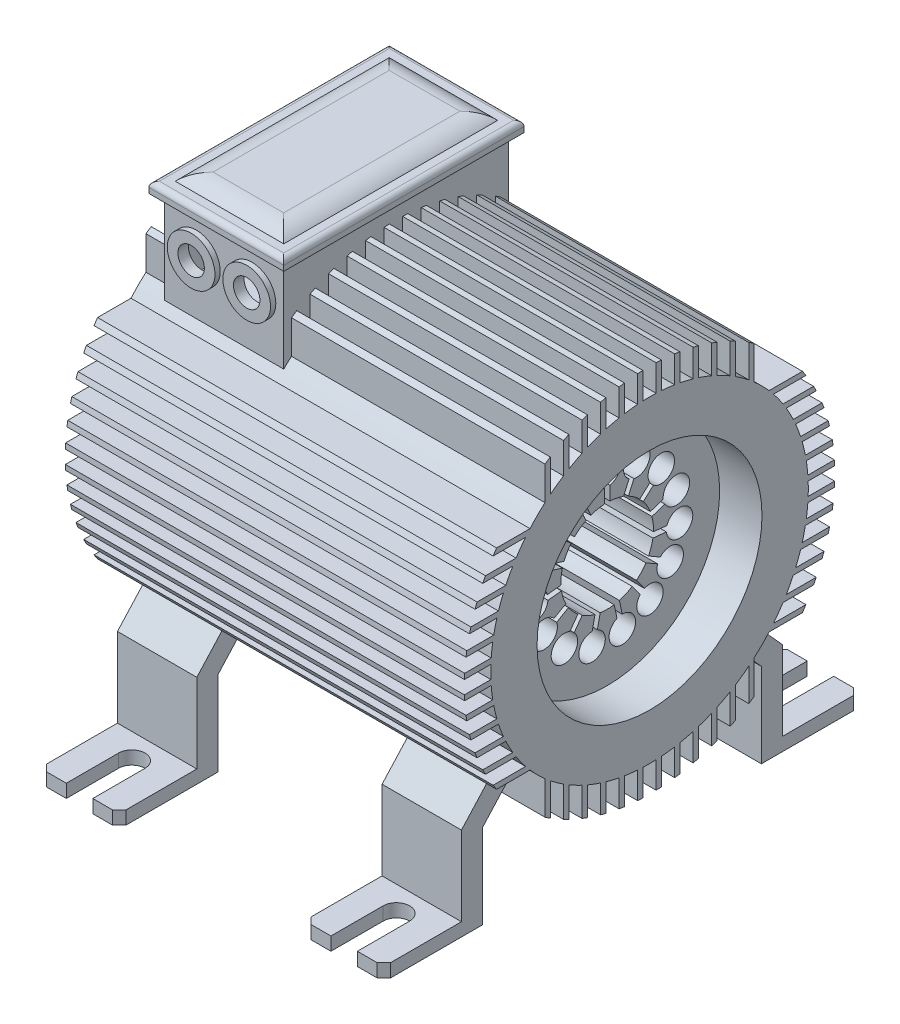
from build123d import *

# Parameters (mm, degrees)
CUT_EXTRUDE2_REACH      = 335.587
CUT_EXTRUDE3_REACH      = 342.367
CIRPATTERN1_START       = 143.1
CIRPATTERN1_DEPTH       = 150.8
BOSS_EXTRUDE4_START     = 50
BOSS_EXTRUDE4_DEPTH     = 15
BOSS_EXTRUDE5_START     = -50
BOSS_EXTRUDE5_DEPTH     = 15
CUT_EXTRUDE5_REACH      = 346.945
CHAMFER2_SIZE           = 2.5
BOSS_EXTRUDE8_START     = -10
BOSS_EXTRUDE8_DEPTH     = 45
SKETCH15_W              = 41
SKETCH15_H              = 80.852813742
CUT_EXTRUDE8_DEPTH      = 30
SKETCH16_R              = 9
BOSS_EXTRUDE9_DEPTH     = 2
BOSS_EXTRUDE10_START    = -86.852814
SKETCH16_3_R            = 9
BOSS_EXTRUDE10_DEPTH    = 2
CUT_EXTRUDE9_DEPTH      = 444.384032682
CUT_EXTRUDE9_DEPTH_BACK = 444.384032682
SKETCH16_4_R            = 5
SKETCH17_W              = 51
SKETCH17_H              = 90.852813742
BOSS_EXTRUDE11_DEPTH    = 4
SKETCH18_W              = 41
SKETCH18_H              = 80.852813742
BOSS_EXTRUDE12_DEPTH    = 3
FILLET1_R               = 10
FILLET2_R               = 2


# Read off the part's stored shape, not the designer's step: CirPattern1
with BuildPart() as part:
    # Sketch1 → Revolve1 (revolve)
    with BuildSketch(Plane.XY, mode=Mode.PRIVATE) as revolve1_sk:
        Polygon((143.1, 297), (293.9, 297), (293.9, 269.5), (277.9, 269.5), (277.9, 244.5), (159.1, 244.5), (159.1, 269.5), (143.1, 269.5), align=None)
    revolve(revolve1_sk.sketch.rotate(Axis((-3.075212366, 227, 0), (1, 0, 0)), 90), axis=Axis((-3.075212366, 227, 0), (1, 0, 0)))

    # Sketch2 → Cut-Extrude2 (cut, up to next)
    with BuildSketch(Plane(origin=(277.9, 0, 0), x_dir=(0, 0, -1), z_dir=(1, 0, 0)), mode=Mode.PRIVATE) as cut_extrude2_sk1:
        with BuildLine():
            Line((-1, 249.601020514), (-1, 244.47140521))
            ThreePointArc((-1, 244.47140521), (0, 244.5), (1, 244.47140521))
            Line((1, 244.47140521), (1, 249.601020514))
            ThreePointArc((1, 249.601020514), (0, 259.5), (-1, 249.601020514))
        make_face()
    cut_extrude2_tool1 = extrude(cut_extrude2_sk1.sketch, amount=-CUT_EXTRUDE2_REACH, mode=Mode.PRIVATE) & part.part
    # Sketch2 → Cut-Extrude2 (cut, up to next)
    with BuildSketch(Plane(origin=(277.9, 0, 0), x_dir=(0, 0, -1), z_dir=(1, 0, 0)), mode=Mode.PRIVATE) as cut_extrude2_sk2:
        with BuildLine():
            Line((8.279117756, 248.053796272), (6.192715247, 243.367659511))
            ThreePointArc((6.192715247, 243.367659511), (7.117891254, 242.987045509), (8.019806162, 242.554186225))
            Line((8.019806162, 242.554186225), (10.106208672, 247.240322986))
            ThreePointArc((10.106208672, 247.240322986), (13.2189409, 256.690227373), (8.279117756, 248.053796272))
        make_face()
    cut_extrude2_tool2 = extrude(cut_extrude2_sk2.sketch, amount=-CUT_EXTRUDE2_REACH, mode=Mode.PRIVATE) & part.part
    # Sketch2 → Cut-Extrude2 (cut, up to next)
    with BuildSketch(Plane(origin=(277.9, 0, 0), x_dir=(0, 0, -1), z_dir=(1, 0, 0)), mode=Mode.PRIVATE) as cut_extrude2_sk3:
        with BuildLine():
            Line((16.126700839, 242.866179387), (12.314653769, 239.433796787))
            ThreePointArc((12.314653769, 239.433796787), (13.005034446, 238.709785611), (13.652914982, 237.947507136))
            Line((13.652914982, 237.947507136), (17.464962052, 241.379889736))
            ThreePointArc((17.464962052, 241.379889736), (24.152206828, 248.746744707), (16.126700839, 242.866179387))
        make_face()
    cut_extrude2_tool3 = extrude(cut_extrude2_sk3.sketch, amount=-CUT_EXTRUDE2_REACH, mode=Mode.PRIVATE) & part.part
    # Sketch2 → Cut-Extrude2 (cut, up to next)
    with BuildSketch(Plane(origin=(277.9, 0, 0), x_dir=(0, 0, -1), z_dir=(1, 0, 0)), mode=Mode.PRIVATE) as cut_extrude2_sk4:
        with BuildLine():
            Line((21.185830841, 234.935155945), (16.307276779, 233.350017642))
            ThreePointArc((16.307276779, 233.350017642), (16.643489035, 232.407797402), (16.925310768, 231.447904609))
            Line((16.925310768, 231.447904609), (21.80386483, 233.033042913))
            ThreePointArc((21.80386483, 233.033042913), (30.90933678, 237.043052317), (21.185830841, 234.935155945))
        make_face()
    cut_extrude2_tool4 = extrude(cut_extrude2_sk4.sketch, amount=-CUT_EXTRUDE2_REACH, mode=Mode.PRIVATE) & part.part
    # Sketch2 → Cut-Extrude2 (cut, up to next)
    with BuildSketch(Plane(origin=(277.9, 0, 0), x_dir=(0, 0, -1), z_dir=(1, 0, 0)), mode=Mode.PRIVATE) as cut_extrude2_sk5:
        with BuildLine():
            Line((22.581738223, 225.632071953), (17.480223487, 226.168262758))
            ThreePointArc((17.480223487, 226.168262758), (17.404133169, 225.170751893), (17.271166561, 224.179218967))
            Line((17.271166561, 224.179218967), (22.372681296, 223.643028162))
            ThreePointArc((22.372681296, 223.643028162), (32.321961599, 223.602824944), (22.581738223, 225.632071953))
        make_face()
    cut_extrude2_tool5 = extrude(cut_extrude2_sk5.sketch, amount=-CUT_EXTRUDE2_REACH, mode=Mode.PRIVATE) & part.part
    # Sketch2 → Cut-Extrude2 (cut, up to next)
    with BuildSketch(Plane(origin=(277.9, 0, 0), x_dir=(0, 0, -1), z_dir=(1, 0, 0)), mode=Mode.PRIVATE) as cut_extrude2_sk6:
        with BuildLine():
            Line((20.073057917, 216.565515147), (15.630680751, 219.130322799))
            ThreePointArc((15.630680751, 219.130322799), (15.155444566, 218.25), (14.630680751, 217.398271991))
            Line((14.630680751, 217.398271991), (19.073057917, 214.833464339))
            ThreePointArc((19.073057917, 214.833464339), (28.145825623, 210.75), (20.073057917, 216.565515147))
        make_face()
    cut_extrude2_tool6 = extrude(cut_extrude2_sk6.sketch, amount=-CUT_EXTRUDE2_REACH, mode=Mode.PRIVATE) & part.part
    # Sketch2 → Cut-Extrude2 (cut, up to next)
    with BuildSketch(Plane(origin=(277.9, 0, 0), x_dir=(0, 0, -1), z_dir=(1, 0, 0)), mode=Mode.PRIVATE) as cut_extrude2_sk7:
        with BuildLine():
            Line((14.09356354, 209.303175566), (11.078451313, 213.453121522))
            ThreePointArc((11.078451313, 213.453121522), (10.286241915, 212.842202598), (9.460417325, 212.277551017))
            Line((9.460417325, 212.277551017), (12.475529551, 208.127605061))
            ThreePointArc((12.475529551, 208.127605061), (19.1030207, 200.706947683), (14.09356354, 209.303175566))
        make_face()
    cut_extrude2_tool7 = extrude(cut_extrude2_sk7.sketch, amount=-CUT_EXTRUDE2_REACH, mode=Mode.PRIVATE) & part.part
    # Sketch2 → Cut-Extrude2 (cut, up to next)
    with BuildSketch(Plane(origin=(277.9, 0, 0), x_dir=(0, 0, -1), z_dir=(1, 0, 0)), mode=Mode.PRIVATE) as cut_extrude2_sk8:
        with BuildLine():
            Line((5.67716399, 205.1007777), (4.610656999, 210.118298604))
            ThreePointArc((4.610656999, 210.118298604), (3.638454589, 209.882416987), (2.654361797, 209.702475222))
            Line((2.654361797, 209.702475222), (3.720868789, 204.684954319))
            ThreePointArc((3.720868789, 204.684954319), (6.757129952, 195.210202976), (5.67716399, 205.1007777))
        make_face()
    cut_extrude2_tool8 = extrude(cut_extrude2_sk8.sketch, amount=-CUT_EXTRUDE2_REACH, mode=Mode.PRIVATE) & part.part
    # Sketch2 → Cut-Extrude2 (cut, up to next)
    with BuildSketch(Plane(origin=(277.9, 0, 0), x_dir=(0, 0, -1), z_dir=(1, 0, 0)), mode=Mode.PRIVATE) as cut_extrude2_sk9:
        with BuildLine():
            Line((-3.720868789, 204.684954319), (-2.654361797, 209.702475222))
            ThreePointArc((-2.654361797, 209.702475222), (-3.638454589, 209.882416987), (-4.610656999, 210.118298604))
            Line((-4.610656999, 210.118298604), (-5.67716399, 205.1007777))
            ThreePointArc((-5.67716399, 205.1007777), (-6.757129952, 195.210202976), (-3.720868789, 204.684954319))
        make_face()
    cut_extrude2_tool9 = extrude(cut_extrude2_sk9.sketch, amount=-CUT_EXTRUDE2_REACH, mode=Mode.PRIVATE) & part.part
    # Sketch2 → Cut-Extrude2 (cut, up to next)
    with BuildSketch(Plane(origin=(277.9, 0, 0), x_dir=(0, 0, -1), z_dir=(1, 0, 0)), mode=Mode.PRIVATE) as cut_extrude2_sk10:
        with BuildLine():
            Line((-12.475529551, 208.127605061), (-9.460417325, 212.277551017))
            ThreePointArc((-9.460417325, 212.277551017), (-10.286241915, 212.842202598), (-11.078451313, 213.453121522))
            Line((-11.078451313, 213.453121522), (-14.09356354, 209.303175566))
            ThreePointArc((-14.09356354, 209.303175566), (-19.1030207, 200.706947683), (-12.475529551, 208.127605061))
        make_face()
    cut_extrude2_tool10 = extrude(cut_extrude2_sk10.sketch, amount=-CUT_EXTRUDE2_REACH, mode=Mode.PRIVATE) & part.part
    # Sketch2 → Cut-Extrude2 (cut, up to next)
    with BuildSketch(Plane(origin=(277.9, 0, 0), x_dir=(0, 0, -1), z_dir=(1, 0, 0)), mode=Mode.PRIVATE) as cut_extrude2_sk11:
        with BuildLine():
            Line((-19.073057917, 214.833464339), (-14.630680751, 217.398271991))
            ThreePointArc((-14.630680751, 217.398271991), (-15.155444566, 218.25), (-15.630680751, 219.130322799))
            Line((-15.630680751, 219.130322799), (-20.073057917, 216.565515147))
            ThreePointArc((-20.073057917, 216.565515147), (-28.145825623, 210.75), (-19.073057917, 214.833464339))
        make_face()
    cut_extrude2_tool11 = extrude(cut_extrude2_sk11.sketch, amount=-CUT_EXTRUDE2_REACH, mode=Mode.PRIVATE) & part.part
    # Sketch2 → Cut-Extrude2 (cut, up to next)
    with BuildSketch(Plane(origin=(277.9, 0, 0), x_dir=(0, 0, -1), z_dir=(1, 0, 0)), mode=Mode.PRIVATE) as cut_extrude2_sk12:
        with BuildLine():
            Line((-22.372681296, 223.643028162), (-17.271166561, 224.179218967))
            ThreePointArc((-17.271166561, 224.179218967), (-17.404133169, 225.170751893), (-17.480223487, 226.168262758))
            Line((-17.480223487, 226.168262758), (-22.581738223, 225.632071953))
            ThreePointArc((-22.581738223, 225.632071953), (-32.321961599, 223.602824944), (-22.372681296, 223.643028162))
        make_face()
    cut_extrude2_tool12 = extrude(cut_extrude2_sk12.sketch, amount=-CUT_EXTRUDE2_REACH, mode=Mode.PRIVATE) & part.part
    # Sketch2 → Cut-Extrude2 (cut, up to next)
    with BuildSketch(Plane(origin=(277.9, 0, 0), x_dir=(0, 0, -1), z_dir=(1, 0, 0)), mode=Mode.PRIVATE) as cut_extrude2_sk13:
        with BuildLine():
            Line((-21.80386483, 233.033042913), (-16.925310768, 231.447904609))
            ThreePointArc((-16.925310768, 231.447904609), (-16.643489035, 232.407797402), (-16.307276779, 233.350017642))
            Line((-16.307276779, 233.350017642), (-21.185830841, 234.935155945))
            ThreePointArc((-21.185830841, 234.935155945), (-30.90933678, 237.043052317), (-21.80386483, 233.033042913))
        make_face()
    cut_extrude2_tool13 = extrude(cut_extrude2_sk13.sketch, amount=-CUT_EXTRUDE2_REACH, mode=Mode.PRIVATE) & part.part
    # Sketch2 → Cut-Extrude2 (cut, up to next)
    with BuildSketch(Plane(origin=(277.9, 0, 0), x_dir=(0, 0, -1), z_dir=(1, 0, 0)), mode=Mode.PRIVATE) as cut_extrude2_sk14:
        with BuildLine():
            Line((-17.464962052, 241.379889736), (-13.652914982, 237.947507136))
            ThreePointArc((-13.652914982, 237.947507136), (-13.005034446, 238.709785611), (-12.314653769, 239.433796787))
            Line((-12.314653769, 239.433796787), (-16.126700839, 242.866179387))
            ThreePointArc((-16.126700839, 242.866179387), (-24.152206828, 248.746744707), (-17.464962052, 241.379889736))
        make_face()
    cut_extrude2_tool14 = extrude(cut_extrude2_sk14.sketch, amount=-CUT_EXTRUDE2_REACH, mode=Mode.PRIVATE) & part.part
    # Sketch2 → Cut-Extrude2 (cut, up to next)
    with BuildSketch(Plane(origin=(277.9, 0, 0), x_dir=(0, 0, -1), z_dir=(1, 0, 0)), mode=Mode.PRIVATE) as cut_extrude2_sk15:
        with BuildLine():
            Line((-10.106208672, 247.240322986), (-8.019806162, 242.554186225))
            ThreePointArc((-8.019806162, 242.554186225), (-7.117891254, 242.987045509), (-6.192715247, 243.367659511))
            Line((-6.192715247, 243.367659511), (-8.279117756, 248.053796272))
            ThreePointArc((-8.279117756, 248.053796272), (-13.2189409, 256.690227373), (-10.106208672, 247.240322986))
        make_face()
    cut_extrude2_tool15 = extrude(cut_extrude2_sk15.sketch, amount=-CUT_EXTRUDE2_REACH, mode=Mode.PRIVATE) & part.part
    add(cut_extrude2_tool1.solids().sort_by_distance((277.9, 253.647833, 0))[0], mode=Mode.SUBTRACT)
    add(cut_extrude2_tool2.solids().sort_by_distance((277.9, 251.344007, -10.83865))[0], mode=Mode.SUBTRACT)
    add(cut_extrude2_tool3.solids().sort_by_distance((277.9, 244.830881, -19.8032))[0], mode=Mode.SUBTRACT)
    add(cut_extrude2_tool4.solids().sort_by_distance((277.9, 235.234633, -25.343596))[0], mode=Mode.SUBTRACT)
    add(cut_extrude2_tool5.solids().sort_by_distance((277.9, 224.214543, -26.501854))[0], mode=Mode.SUBTRACT)
    add(cut_extrude2_tool6.solids().sort_by_distance((277.9, 213.676083, -23.077701))[0], mode=Mode.SUBTRACT)
    add(cut_extrude2_tool7.solids().sort_by_distance((277.9, 205.44145, -15.663204))[0], mode=Mode.SUBTRACT)
    add(cut_extrude2_tool8.solids().sort_by_distance((277.9, 200.934486, -5.540396))[0], mode=Mode.SUBTRACT)
    add(cut_extrude2_tool9.solids().sort_by_distance((277.9, 200.934486, 5.540396))[0], mode=Mode.SUBTRACT)
    add(cut_extrude2_tool10.solids().sort_by_distance((277.9, 205.44145, 15.663204))[0], mode=Mode.SUBTRACT)
    add(cut_extrude2_tool11.solids().sort_by_distance((277.9, 213.676083, 23.077701))[0], mode=Mode.SUBTRACT)
    add(cut_extrude2_tool12.solids().sort_by_distance((277.9, 224.214543, 26.501854))[0], mode=Mode.SUBTRACT)
    add(cut_extrude2_tool13.solids().sort_by_distance((277.9, 235.234633, 25.343596))[0], mode=Mode.SUBTRACT)
    add(cut_extrude2_tool14.solids().sort_by_distance((277.9, 244.830881, 19.8032))[0], mode=Mode.SUBTRACT)
    add(cut_extrude2_tool15.solids().sort_by_distance((277.9, 251.344007, 10.83865))[0], mode=Mode.SUBTRACT)

    # Sketch4 → Cut-Extrude3 (cut, up to next)
    with BuildSketch(Plane(origin=(293.9, 0, 0), x_dir=(0, 0, -1), z_dir=(1, 0, 0)), mode=Mode.PRIVATE) as cut_extrude3_sk1:
        with BuildLine():
            ThreePointArc((9.5, 296.352361171), (7.0045138, 296.648666796), (4.5, 296.855207394))
            Line((4.5, 296.855207394), (4.5, 286.831012026))
            ThreePointArc((4.5, 286.831012026), (7.006168531, 286.589542728), (9.5, 286.243143063))
            Line((9.5, 286.243143063), (9.5, 296.352361171))
        make_face()
    cut_extrude3_tool1 = extrude(cut_extrude3_sk1.sketch, amount=-CUT_EXTRUDE3_REACH, mode=Mode.PRIVATE) & part.part
    # Sketch4 → Cut-Extrude3 (cut, up to next)
    with BuildSketch(Plane(origin=(293.9, 0, 0), x_dir=(0, 0, -1), z_dir=(1, 0, 0)), mode=Mode.PRIVATE) as cut_extrude3_sk2:
        with BuildLine():
            Line((2.5, 286.947894041), (2.5, 296.955342898))
            ThreePointArc((2.5, 296.955342898), (0, 297), (-2.5, 296.955342898))
            Line((-2.5, 296.955342898), (-2.5, 286.947894041))
            ThreePointArc((-2.5, 286.947894041), (0, 287), (2.5, 286.947894041))
        make_face()
    cut_extrude3_tool2 = extrude(cut_extrude3_sk2.sketch, amount=-CUT_EXTRUDE3_REACH, mode=Mode.PRIVATE) & part.part
    # Sketch4 → Cut-Extrude3 (cut, up to next)
    with BuildSketch(Plane(origin=(293.9, 0, 0), x_dir=(0, 0, -1), z_dir=(1, 0, 0)), mode=Mode.PRIVATE) as cut_extrude3_sk3:
        with BuildLine():
            ThreePointArc((16.5, 295.027567941), (14.00931039, 295.583811664), (11.5, 296.048895719))
            Line((11.5, 296.048895719), (11.5, 285.887604808))
            ThreePointArc((11.5, 285.887604808), (14.012871618, 285.340718448), (16.5, 284.686653569))
            Line((16.5, 284.686653569), (16.5, 295.027567941))
        make_face()
    cut_extrude3_tool3 = extrude(cut_extrude3_sk3.sketch, amount=-CUT_EXTRUDE3_REACH, mode=Mode.PRIVATE) & part.part
    # Sketch4 → Cut-Extrude3 (cut, up to next)
    with BuildSketch(Plane(origin=(293.9, 0, 0), x_dir=(0, 0, -1), z_dir=(1, 0, 0)), mode=Mode.PRIVATE) as cut_extrude3_sk4:
        with BuildLine():
            Line((-4.5, 286.831012026), (-4.5, 296.855207394))
            ThreePointArc((-4.5, 296.855207394), (-7.0045138, 296.648666796), (-9.5, 296.352361171))
            Line((-9.5, 296.352361171), (-9.5, 286.243143063))
            ThreePointArc((-9.5, 286.243143063), (-7.006168531, 286.589542728), (-4.5, 286.831012026))
        make_face()
    cut_extrude3_tool4 = extrude(cut_extrude3_sk4.sketch, amount=-CUT_EXTRUDE3_REACH, mode=Mode.PRIVATE) & part.part
    # Sketch4 → Cut-Extrude3 (cut, up to next)
    with BuildSketch(Plane(origin=(293.9, 0, 0), x_dir=(0, 0, -1), z_dir=(1, 0, 0)), mode=Mode.PRIVATE) as cut_extrude3_sk5:
        with BuildLine():
            ThreePointArc((23.5, 292.937470379), (21.014734963, 293.771108381), (18.5, 294.511110197))
            Line((18.5, 294.511110197), (18.5, 284.076702778))
            ThreePointArc((18.5, 284.076702778), (21.020810625, 283.197202072), (23.5, 282.206430785))
            Line((23.5, 282.206430785), (23.5, 292.937470379))
        make_face()
    cut_extrude3_tool5 = extrude(cut_extrude3_sk5.sketch, amount=-CUT_EXTRUDE3_REACH, mode=Mode.PRIVATE) & part.part
    # Sketch4 → Cut-Extrude3 (cut, up to next)
    with BuildSketch(Plane(origin=(293.9, 0, 0), x_dir=(0, 0, -1), z_dir=(1, 0, 0)), mode=Mode.PRIVATE) as cut_extrude3_sk6:
        with BuildLine():
            Line((-11.5, 285.887604808), (-11.5, 296.048895719))
            ThreePointArc((-11.5, 296.048895719), (-14.00931039, 295.583811664), (-16.5, 295.027567941))
            Line((-16.5, 295.027567941), (-16.5, 284.686653569))
            ThreePointArc((-16.5, 284.686653569), (-14.012871618, 285.340718448), (-11.5, 285.887604808))
        make_face()
    cut_extrude3_tool6 = extrude(cut_extrude3_sk6.sketch, amount=-CUT_EXTRUDE3_REACH, mode=Mode.PRIVATE) & part.part
    # Sketch4 → Cut-Extrude3 (cut, up to next)
    with BuildSketch(Plane(origin=(293.9, 0, 0), x_dir=(0, 0, -1), z_dir=(1, 0, 0)), mode=Mode.PRIVATE) as cut_extrude3_sk7:
        with BuildLine():
            ThreePointArc((30.5, 290.0059521), (28.02128892, 291.146764277), (25.5, 292.190106611))
            Line((25.5, 292.190106611), (25.5, 281.311600971))
            ThreePointArc((25.5, 281.311600971), (28.031143593, 280.049552202), (30.5, 278.669623571))
            Line((30.5, 278.669623571), (30.5, 290.0059521))
        make_face()
    cut_extrude3_tool7 = extrude(cut_extrude3_sk7.sketch, amount=-CUT_EXTRUDE3_REACH, mode=Mode.PRIVATE) & part.part
    # Sketch4 → Cut-Extrude3 (cut, up to next)
    with BuildSketch(Plane(origin=(293.9, 0, 0), x_dir=(0, 0, -1), z_dir=(1, 0, 0)), mode=Mode.PRIVATE) as cut_extrude3_sk8:
        with BuildLine():
            Line((-18.5, 284.076702778), (-18.5, 294.511110197))
            ThreePointArc((-18.5, 294.511110197), (-21.014734963, 293.771108381), (-23.5, 292.937470379))
            Line((-23.5, 292.937470379), (-23.5, 282.206430785))
            ThreePointArc((-23.5, 282.206430785), (-21.020810625, 283.197202072), (-18.5, 284.076702778))
        make_face()
    cut_extrude3_tool8 = extrude(cut_extrude3_sk8.sketch, amount=-CUT_EXTRUDE3_REACH, mode=Mode.PRIVATE) & part.part
    # Sketch4 → Cut-Extrude3 (cut, up to next)
    with BuildSketch(Plane(origin=(293.9, 0, 0), x_dir=(0, 0, -1), z_dir=(1, 0, 0)), mode=Mode.PRIVATE) as cut_extrude3_sk9:
        with BuildLine():
            ThreePointArc((37.5, 286.107952088), (35.029816883, 287.6045537), (32.5, 288.997983838))
            Line((32.5, 288.997983838), (32.5, 277.435602505))
            ThreePointArc((32.5, 277.435602505), (35.046206819, 275.70075346), (37.5, 273.837484988))
            Line((37.5, 273.837484988), (37.5, 286.107952088))
        make_face()
    cut_extrude3_tool9 = extrude(cut_extrude3_sk9.sketch, amount=-CUT_EXTRUDE3_REACH, mode=Mode.PRIVATE) & part.part
    # Sketch4 → Cut-Extrude3 (cut, up to next)
    with BuildSketch(Plane(origin=(293.9, 0, 0), x_dir=(0, 0, -1), z_dir=(1, 0, 0)), mode=Mode.PRIVATE) as cut_extrude3_sk10:
        with BuildLine():
            Line((-25.5, 281.311600971), (-25.5, 292.190106611))
            ThreePointArc((-25.5, 292.190106611), (-28.02128892, 291.146764277), (-30.5, 290.0059521))
            Line((-30.5, 290.0059521), (-30.5, 278.669623571))
            ThreePointArc((-30.5, 278.669623571), (-28.031143593, 280.049552202), (-25.5, 281.311600971))
        make_face()
    cut_extrude3_tool10 = extrude(cut_extrude3_sk10.sketch, amount=-CUT_EXTRUDE3_REACH, mode=Mode.PRIVATE) & part.part
    # Sketch4 → Cut-Extrude3 (cut, up to next)
    with BuildSketch(Plane(origin=(293.9, 0, 0), x_dir=(0, 0, -1), z_dir=(1, 0, 0)), mode=Mode.PRIVATE) as cut_extrude3_sk11:
        with BuildLine():
            ThreePointArc((44.5, 281.034711066), (42.041962602, 282.968503469), (39.5, 284.790570165))
            Line((39.5, 284.790570165), (39.5, 272.163591531))
            ThreePointArc((39.5, 272.163591531), (42.071907336, 269.777968782), (44.5, 267.246117825))
            Line((44.5, 267.246117825), (44.5, 281.034711066))
        make_face()
    cut_extrude3_tool11 = extrude(cut_extrude3_sk11.sketch, amount=-CUT_EXTRUDE3_REACH, mode=Mode.PRIVATE) & part.part
    # Sketch4 → Cut-Extrude3 (cut, up to next)
    with BuildSketch(Plane(origin=(293.9, 0, 0), x_dir=(0, 0, -1), z_dir=(1, 0, 0)), mode=Mode.PRIVATE) as cut_extrude3_sk12:
        with BuildLine():
            Line((-32.5, 277.435602505), (-32.5, 288.997983838))
            ThreePointArc((-32.5, 288.997983838), (-35.029816883, 287.6045537), (-37.5, 286.107952088))
            Line((-37.5, 286.107952088), (-37.5, 273.837484988))
            ThreePointArc((-37.5, 273.837484988), (-35.046206819, 275.70075346), (-32.5, 277.435602505))
        make_face()
    cut_extrude3_tool12 = extrude(cut_extrude3_sk12.sketch, amount=-CUT_EXTRUDE3_REACH, mode=Mode.PRIVATE) & part.part
    # Sketch4 → Cut-Extrude3 (cut, up to next)
    with BuildSketch(Plane(origin=(293.9, 0, 0), x_dir=(0, 0, -1), z_dir=(1, 0, 0)), mode=Mode.PRIVATE) as cut_extrude3_sk13:
        with BuildLine():
            ThreePointArc((51.5, 274.410441888), (49.061538568, 276.929604779), (46.5, 279.323512879))
            Line((46.5, 279.323512879), (46.5, 267))
            Line((46.5, 267), (51.5, 267))
            Line((51.5, 267), (51.5, 274.410441888))
        make_face()
    cut_extrude3_tool13 = extrude(cut_extrude3_sk13.sketch, amount=-CUT_EXTRUDE3_REACH, mode=Mode.PRIVATE) & part.part
    # Sketch4 → Cut-Extrude3 (cut, up to next)
    with BuildSketch(Plane(origin=(293.9, 0, 0), x_dir=(0, 0, -1), z_dir=(1, 0, 0)), mode=Mode.PRIVATE) as cut_extrude3_sk14:
        with BuildLine():
            Line((-39.5, 272.163591531), (-39.5, 284.790570165))
            ThreePointArc((-39.5, 284.790570165), (-42.041962602, 282.968503469), (-44.5, 281.034711066))
            Line((-44.5, 281.034711066), (-44.5, 267.246117825))
            ThreePointArc((-44.5, 267.246117825), (-42.071907336, 269.777968782), (-39.5, 272.163591531))
        make_face()
    cut_extrude3_tool14 = extrude(cut_extrude3_sk14.sketch, amount=-CUT_EXTRUDE3_REACH, mode=Mode.PRIVATE) & part.part
    # Sketch4 → Cut-Extrude3 (cut, up to next)
    with BuildSketch(Plane(origin=(293.9, 0, 0), x_dir=(0, 0, -1), z_dir=(1, 0, 0)), mode=Mode.PRIVATE) as cut_extrude3_sk15:
        with BuildLine():
            ThreePointArc((-46.5, 279.323512879), (-49.061538568, 276.929604779), (-51.5, 274.410441888))
            Line((-51.5, 274.410441888), (-51.5, 267))
            Line((-51.5, 267), (-46.5, 267))
            Line((-46.5, 267), (-46.5, 279.323512879))
        make_face()
    cut_extrude3_tool15 = extrude(cut_extrude3_sk15.sketch, amount=-CUT_EXTRUDE3_REACH, mode=Mode.PRIVATE) & part.part
    add(cut_extrude3_tool1.solids().sort_by_distance((293.9, 291.602889, -7.003518))[0], mode=Mode.SUBTRACT)
    add(cut_extrude3_tool2.solids().sort_by_distance((293.9, 291.983872, 0))[0], mode=Mode.SUBTRACT)
    add(cut_extrude3_tool3.solids().sort_by_distance((293.9, 290.445779, -14.007298))[0], mode=Mode.SUBTRACT)
    add(cut_extrude3_tool4.solids().sort_by_distance((293.9, 291.602889, 7.003518))[0], mode=Mode.SUBTRACT)
    add(cut_extrude3_tool5.solids().sort_by_distance((293.9, 288.467199, -21.011674))[0], mode=Mode.SUBTRACT)
    add(cut_extrude3_tool6.solids().sort_by_distance((293.9, 290.445779, 14.007298))[0], mode=Mode.SUBTRACT)
    add(cut_extrude3_tool7.solids().sort_by_distance((293.9, 285.580512, -28.017165))[0], mode=Mode.SUBTRACT)
    add(cut_extrude3_tool8.solids().sort_by_distance((293.9, 288.467199, 21.011674))[0], mode=Mode.SUBTRACT)
    add(cut_extrude3_tool9.solids().sort_by_distance((293.9, 281.634128, -35.024744))[0], mode=Mode.SUBTRACT)
    add(cut_extrude3_tool10.solids().sort_by_distance((293.9, 285.580512, 28.017165))[0], mode=Mode.SUBTRACT)
    add(cut_extrude3_tool11.solids().sort_by_distance((293.9, 276.354063, -42.036615))[0], mode=Mode.SUBTRACT)
    add(cut_extrude3_tool12.solids().sort_by_distance((293.9, 281.634128, 35.024744))[0], mode=Mode.SUBTRACT)
    add(cut_extrude3_tool13.solids().sort_by_distance((293.9, 272.075485, -48.794443))[0], mode=Mode.SUBTRACT)
    add(cut_extrude3_tool14.solids().sort_by_distance((293.9, 276.354063, 42.036615))[0], mode=Mode.SUBTRACT)
    add(cut_extrude3_tool15.solids().sort_by_distance((293.9, 272.075485, 48.794443))[0], mode=Mode.SUBTRACT)

    # CirPattern1 outline → CirPattern1 (cut)
    with BuildSketch(Plane.YZ.offset(CIRPATTERN1_START)):
        with BuildLine():
            ThreePointArc((274.410441888, 51.5), (270.568899981, 54.788237373), (266.5, 57.790570165))
            Line((266.5, 57.790570165), (266.5, 45.163591531))
            ThreePointArc((266.5, 45.163591531), (266.874439375, 44.833347907), (267.246117825, 44.5))
            Line((267.246117825, 44.5), (281.034711066, 44.5))
            ThreePointArc((281.034711066, 44.5), (280.188513329, 45.508043792), (279.323512879, 46.5))
            Line((279.323512879, 46.5), (267, 46.5))
            Line((267, 46.5), (267, 51.5))
            Line((267, 51.5), (274.410441888, 51.5))
        make_face()
        with BuildLine():
            ThreePointArc((264.5, 59.107952088), (262.029816883, 60.6045537), (259.5, 61.997983838))
            Line((259.5, 61.997983838), (259.5, 50.435602505))
            ThreePointArc((259.5, 50.435602505), (262.046206819, 48.70075346), (264.5, 46.837484988))
            Line((264.5, 46.837484988), (264.5, 59.107952088))
        make_face()
        with BuildLine():
            ThreePointArc((257.5, 63.0059521), (255.02128892, 64.146764278), (252.5, 65.190106611))
            Line((252.5, 65.190106611), (252.5, 54.311600971))
            ThreePointArc((252.5, 54.311600971), (255.031143593, 53.049552202), (257.5, 51.669623571))
            Line((257.5, 51.669623571), (257.5, 63.0059521))
        make_face()
        with BuildLine():
            ThreePointArc((250.5, 65.937470379), (248.014734963, 66.771108381), (245.5, 67.511110197))
            Line((245.5, 67.511110197), (245.5, 57.076702778))
            ThreePointArc((245.5, 57.076702778), (248.020810625, 56.197202072), (250.5, 55.206430785))
            Line((250.5, 55.206430785), (250.5, 65.937470379))
        make_face()
        with BuildLine():
            ThreePointArc((243.5, 68.027567941), (241.00931039, 68.583811664), (238.5, 69.048895719))
            Line((238.5, 69.048895719), (238.5, 58.887604808))
            ThreePointArc((238.5, 58.887604808), (241.012871618, 58.340718448), (243.5, 57.686653569))
            Line((243.5, 57.686653569), (243.5, 68.027567941))
        make_face()
        with BuildLine():
            ThreePointArc((236.5, 69.352361171), (234.0045138, 69.648666796), (231.5, 69.855207394))
            Line((231.5, 69.855207394), (231.5, 59.831012026))
            ThreePointArc((231.5, 59.831012026), (234.006168531, 59.589542728), (236.5, 59.243143063))
            Line((236.5, 59.243143063), (236.5, 69.352361171))
        make_face()
        with BuildLine():
            ThreePointArc((229.5, 69.955342898), (227, 70), (224.5, 69.955342898))
            Line((224.5, 69.955342898), (224.5, 59.947894041))
            ThreePointArc((224.5, 59.947894041), (227, 60), (229.5, 59.947894041))
            Line((229.5, 59.947894041), (229.5, 69.955342898))
        make_face()
        with BuildLine():
            ThreePointArc((222.5, 69.855207394), (219.9954862, 69.648666796), (217.5, 69.352361171))
            Line((217.5, 69.352361171), (217.5, 59.243143063))
            ThreePointArc((217.5, 59.243143063), (219.993831469, 59.589542728), (222.5, 59.831012026))
            Line((222.5, 59.831012026), (222.5, 69.855207394))
        make_face()
        with BuildLine():
            ThreePointArc((215.5, 69.048895719), (212.99068961, 68.583811664), (210.5, 68.027567941))
            Line((210.5, 68.027567941), (210.5, 57.686653569))
            ThreePointArc((210.5, 57.686653569), (212.987128382, 58.340718448), (215.5, 58.887604808))
            Line((215.5, 58.887604808), (215.5, 69.048895719))
        make_face()
        with BuildLine():
            ThreePointArc((208.5, 67.511110197), (205.985265037, 66.771108381), (203.5, 65.937470379))
            Line((203.5, 65.937470379), (203.5, 55.206430785))
            ThreePointArc((203.5, 55.206430785), (205.979189375, 56.197202072), (208.5, 57.076702778))
            Line((208.5, 57.076702778), (208.5, 67.511110197))
        make_face()
        with BuildLine():
            ThreePointArc((201.5, 65.190106611), (198.97871108, 64.146764277), (196.5, 63.0059521))
            Line((196.5, 63.0059521), (196.5, 51.669623571))
            ThreePointArc((196.5, 51.669623571), (198.968856407, 53.049552202), (201.5, 54.311600971))
            Line((201.5, 54.311600971), (201.5, 65.190106611))
        make_face()
        with BuildLine():
            ThreePointArc((194.5, 61.997983838), (191.970183117, 60.6045537), (189.5, 59.107952088))
            Line((189.5, 59.107952088), (189.5, 46.837484988))
            ThreePointArc((189.5, 46.837484988), (191.953793181, 48.70075346), (194.5, 50.435602505))
            Line((194.5, 50.435602505), (194.5, 61.997983838))
        make_face()
        with BuildLine():
            ThreePointArc((187.5, 57.790570165), (177.502525317, 49.497474683), (169.209429835, 39.5))
            Line((169.209429835, 39.5), (181.836408469, 39.5))
            ThreePointArc((181.836408469, 39.5), (184.573593129, 42.426406871), (187.5, 45.163591531))
            Line((187.5, 45.163591531), (187.5, 57.790570165))
        make_face()
        with BuildLine():
            ThreePointArc((167.892047912, 37.5), (166.3954463, 35.029816883), (165.002016162, 32.5))
            Line((165.002016162, 32.5), (176.564397495, 32.5))
            ThreePointArc((176.564397495, 32.5), (178.29924654, 35.046206819), (180.162515012, 37.5))
            Line((180.162515012, 37.5), (167.892047912, 37.5))
        make_face()
        with BuildLine():
            ThreePointArc((163.9940479, 30.5), (162.853235723, 28.02128892), (161.809893389, 25.5))
            Line((161.809893389, 25.5), (172.688399029, 25.5))
            ThreePointArc((172.688399029, 25.5), (173.950447798, 28.031143593), (175.330376429, 30.5))
            Line((175.330376429, 30.5), (163.9940479, 30.5))
        make_face()
        with BuildLine():
            ThreePointArc((161.062529621, 23.5), (160.228891619, 21.014734963), (159.488889803, 18.5))
            Line((159.488889803, 18.5), (169.923297222, 18.5))
            ThreePointArc((169.923297222, 18.5), (170.802797928, 21.020810625), (171.793569215, 23.5))
            Line((171.793569215, 23.5), (161.062529621, 23.5))
        make_face()
        with BuildLine():
            ThreePointArc((158.972432059, 16.5), (158.416188336, 14.00931039), (157.951104281, 11.5))
            Line((157.951104281, 11.5), (168.112395192, 11.5))
            ThreePointArc((168.112395192, 11.5), (168.659281552, 14.012871618), (169.313346431, 16.5))
            Line((169.313346431, 16.5), (158.972432059, 16.5))
        make_face()
        with BuildLine():
            ThreePointArc((157.647638829, 9.5), (157.351333204, 7.0045138), (157.144792606, 4.5))
            Line((157.144792606, 4.5), (167.168987974, 4.5))
            ThreePointArc((167.168987974, 4.5), (167.410457272, 7.006168531), (167.756856937, 9.5))
            Line((167.756856937, 9.5), (157.647638829, 9.5))
        make_face()
        with BuildLine():
            ThreePointArc((157.044657102, 2.5), (157, 0), (157.044657102, -2.5))
            Line((157.044657102, -2.5), (167.052105959, -2.5))
            ThreePointArc((167.052105959, -2.5), (167, 0), (167.052105959, 2.5))
            Line((167.052105959, 2.5), (157.044657102, 2.5))
        make_face()
        with BuildLine():
            ThreePointArc((157.144792606, -4.5), (157.351333204, -7.0045138), (157.647638829, -9.5))
            Line((157.647638829, -9.5), (167.756856937, -9.5))
            ThreePointArc((167.756856937, -9.5), (167.410457272, -7.006168531), (167.168987974, -4.5))
            Line((167.168987974, -4.5), (157.144792606, -4.5))
        make_face()
        with BuildLine():
            ThreePointArc((157.951104281, -11.5), (158.416188336, -14.00931039), (158.972432059, -16.5))
            Line((158.972432059, -16.5), (169.313346431, -16.5))
            ThreePointArc((169.313346431, -16.5), (168.659281552, -14.012871618), (168.112395192, -11.5))
            Line((168.112395192, -11.5), (157.951104281, -11.5))
        make_face()
        with BuildLine():
            ThreePointArc((159.488889803, -18.5), (160.228891619, -21.014734963), (161.062529621, -23.5))
            Line((161.062529621, -23.5), (171.793569215, -23.5))
            ThreePointArc((171.793569215, -23.5), (170.802797928, -21.020810625), (169.923297222, -18.5))
            Line((169.923297222, -18.5), (159.488889803, -18.5))
        make_face()
        with BuildLine():
            ThreePointArc((161.809893389, -25.5), (162.853235723, -28.02128892), (163.9940479, -30.5))
            Line((163.9940479, -30.5), (175.330376429, -30.5))
            ThreePointArc((175.330376429, -30.5), (173.950447798, -28.031143593), (172.688399029, -25.5))
            Line((172.688399029, -25.5), (161.809893389, -25.5))
        make_face()
        with BuildLine():
            ThreePointArc((165.002016162, -32.5), (166.3954463, -35.029816883), (167.892047912, -37.5))
            Line((167.892047912, -37.5), (180.162515012, -37.5))
            ThreePointArc((180.162515012, -37.5), (178.29924654, -35.046206819), (176.564397495, -32.5))
            Line((176.564397495, -32.5), (165.002016162, -32.5))
        make_face()
        with BuildLine():
            ThreePointArc((169.209429835, -39.5), (177.502525317, -49.497474683), (187.5, -57.790570165))
            Line((187.5, -57.790570165), (187.5, -45.163591531))
            ThreePointArc((187.5, -45.163591531), (184.573593129, -42.426406871), (181.836408469, -39.5))
            Line((181.836408469, -39.5), (169.209429835, -39.5))
        make_face()
        with BuildLine():
            ThreePointArc((189.5, -59.107952088), (191.970183117, -60.6045537), (194.5, -61.997983838))
            Line((194.5, -61.997983838), (194.5, -50.435602505))
            ThreePointArc((194.5, -50.435602505), (191.953793181, -48.70075346), (189.5, -46.837484988))
            Line((189.5, -46.837484988), (189.5, -59.107952088))
        make_face()
        with BuildLine():
            ThreePointArc((196.5, -63.0059521), (198.97871108, -64.146764277), (201.5, -65.190106611))
            Line((201.5, -65.190106611), (201.5, -54.311600971))
            ThreePointArc((201.5, -54.311600971), (198.968856407, -53.049552202), (196.5, -51.669623571))
            Line((196.5, -51.669623571), (196.5, -63.0059521))
        make_face()
        with BuildLine():
            ThreePointArc((203.5, -65.937470379), (205.985265037, -66.771108381), (208.5, -67.511110197))
            Line((208.5, -67.511110197), (208.5, -57.076702778))
            ThreePointArc((208.5, -57.076702778), (205.979189375, -56.197202072), (203.5, -55.206430785))
            Line((203.5, -55.206430785), (203.5, -65.937470379))
        make_face()
        with BuildLine():
            ThreePointArc((210.5, -68.027567941), (212.99068961, -68.583811664), (215.5, -69.048895719))
            Line((215.5, -69.048895719), (215.5, -58.887604808))
            ThreePointArc((215.5, -58.887604808), (212.987128382, -58.340718448), (210.5, -57.686653569))
            Line((210.5, -57.686653569), (210.5, -68.027567941))
        make_face()
        with BuildLine():
            ThreePointArc((217.5, -69.352361171), (219.9954862, -69.648666796), (222.5, -69.855207394))
            Line((222.5, -69.855207394), (222.5, -59.831012026))
            ThreePointArc((222.5, -59.831012026), (219.993831469, -59.589542728), (217.5, -59.243143063))
            Line((217.5, -59.243143063), (217.5, -69.352361171))
        make_face()
        with BuildLine():
            ThreePointArc((224.5, -69.955342898), (227, -70), (229.5, -69.955342898))
            Line((229.5, -69.955342898), (229.5, -59.947894041))
            ThreePointArc((229.5, -59.947894041), (227, -60), (224.5, -59.947894041))
            Line((224.5, -59.947894041), (224.5, -69.955342898))
        make_face()
        with BuildLine():
            ThreePointArc((231.5, -69.855207394), (234.0045138, -69.648666796), (236.5, -69.352361171))
            Line((236.5, -69.352361171), (236.5, -59.243143063))
            ThreePointArc((236.5, -59.243143063), (234.006168531, -59.589542728), (231.5, -59.831012026))
            Line((231.5, -59.831012026), (231.5, -69.855207394))
        make_face()
        with BuildLine():
            ThreePointArc((238.5, -69.048895719), (241.00931039, -68.583811664), (243.5, -68.027567941))
            Line((243.5, -68.027567941), (243.5, -57.686653569))
            ThreePointArc((243.5, -57.686653569), (241.012871618, -58.340718448), (238.5, -58.887604808))
            Line((238.5, -58.887604808), (238.5, -69.048895719))
        make_face()
        with BuildLine():
            ThreePointArc((245.5, -67.511110197), (248.014734963, -66.771108381), (250.5, -65.937470379))
            Line((250.5, -65.937470379), (250.5, -55.206430785))
            ThreePointArc((250.5, -55.206430785), (248.020810625, -56.197202072), (245.5, -57.076702778))
            Line((245.5, -57.076702778), (245.5, -67.511110197))
        make_face()
        with BuildLine():
            ThreePointArc((252.5, -65.190106611), (255.02128892, -64.146764278), (257.5, -63.0059521))
            Line((257.5, -63.0059521), (257.5, -51.669623571))
            ThreePointArc((257.5, -51.669623571), (255.031143593, -53.049552202), (252.5, -54.311600971))
            Line((252.5, -54.311600971), (252.5, -65.190106611))
        make_face()
        with BuildLine():
            ThreePointArc((259.5, -61.997983838), (262.029816883, -60.6045537), (264.5, -59.107952088))
            Line((264.5, -59.107952088), (264.5, -46.837484988))
            ThreePointArc((264.5, -46.837484988), (262.046206819, -48.70075346), (259.5, -50.435602505))
            Line((259.5, -50.435602505), (259.5, -61.997983838))
        make_face()
        with BuildLine():
            ThreePointArc((267.246117825, -44.5), (266.874439375, -44.833347907), (266.5, -45.163591531))
            Line((266.5, -45.163591531), (266.5, -57.790570165))
            ThreePointArc((266.5, -57.790570165), (270.568899981, -54.788237373), (274.410441888, -51.5))
            Line((274.410441888, -51.5), (267, -51.5))
            Line((267, -51.5), (267, -46.5))
            Line((267, -46.5), (279.323512879, -46.5))
            ThreePointArc((279.323512879, -46.5), (280.188513329, -45.508043792), (281.034711066, -44.5))
            Line((281.034711066, -44.5), (267.246117825, -44.5))
        make_face()
    extrude(amount=CIRPATTERN1_DEPTH, mode=Mode.SUBTRACT)

    # Sketch8 → Boss-Extrude4 (add, symmetric)
    with BuildSketch(Plane(origin=(218.5, 0, 0), x_dir=(0, 0, -1), z_dir=(1, 0, 0)).offset(BOSS_EXTRUDE4_START)):
        with BuildLine():
            Line((45.163591531, 187.5), (60.671660632, 170.4))
            Line((60.671660632, 170.4), (60.671660632, 140.4))
            Line((60.671660632, 140.4), (90, 140.4))
            Line((90, 140.4), (90, 135.4))
            Line((90, 135.4), (52.671660632, 135.4))
            Line((52.671660632, 135.4), (52.671660632, 167.312653426))
            Line((52.671660632, 167.312653426), (39.5, 181.836408469))
            ThreePointArc((39.5, 181.836408469), (42.426406871, 184.573593129), (45.163591531, 187.5))
        make_face()
        with BuildLine():
            Line((-52.671660632, 167.312653426), (-39.5, 181.836408469))
            ThreePointArc((-39.5, 181.836408469), (-42.426406871, 184.573593129), (-45.163591531, 187.5))
            Line((-45.163591531, 187.5), (-60.671660632, 170.4))
            Line((-60.671660632, 170.4), (-60.671660632, 140.4))
            Line((-60.671660632, 140.4), (-90, 140.4))
            Line((-90, 140.4), (-90, 135.4))
            Line((-90, 135.4), (-52.671660632, 135.4))
            Line((-52.671660632, 135.4), (-52.671660632, 167.312653426))
        make_face()
    extrude(amount=BOSS_EXTRUDE4_DEPTH, both=True)

    # Sketch8<2> → Boss-Extrude5 (add, symmetric)
    with BuildSketch(Plane(origin=(218.5, 0, 0), x_dir=(0, 0, -1), z_dir=(1, 0, 0)).offset(BOSS_EXTRUDE5_START)):
        with BuildLine():
            Line((45.163591531, 187.5), (60.671660632, 170.4))
            Line((60.671660632, 170.4), (60.671660632, 140.4))
            Line((60.671660632, 140.4), (90, 140.4))
            Line((90, 140.4), (90, 135.4))
            Line((90, 135.4), (52.671660632, 135.4))
            Line((52.671660632, 135.4), (52.671660632, 167.312653426))
            Line((52.671660632, 167.312653426), (39.5, 181.836408469))
            ThreePointArc((39.5, 181.836408469), (42.426406871, 184.573593129), (45.163591531, 187.5))
        make_face()
        with BuildLine():
            Line((-52.671660632, 167.312653426), (-39.5, 181.836408469))
            ThreePointArc((-39.5, 181.836408469), (-42.426406871, 184.573593129), (-45.163591531, 187.5))
            Line((-45.163591531, 187.5), (-60.671660632, 170.4))
            Line((-60.671660632, 170.4), (-60.671660632, 140.4))
            Line((-60.671660632, 140.4), (-90, 140.4))
            Line((-90, 140.4), (-90, 135.4))
            Line((-90, 135.4), (-52.671660632, 135.4))
            Line((-52.671660632, 135.4), (-52.671660632, 167.312653426))
        make_face()
    extrude(amount=BOSS_EXTRUDE5_DEPTH, both=True)

    # Sketch11 → Cut-Extrude5 (cut, up to next)
    with BuildSketch(Plane(origin=(0, 140.4, 0), x_dir=(1, 0, 0), z_dir=(0, 1, 0)), mode=Mode.PRIVATE) as cut_extrude5_sk1:
        with BuildLine():
            Line((163.5, -90), (163.5, -70.25))
            ThreePointArc((163.5, -70.25), (168.5, -65.25), (173.5, -70.25))
            Line((173.5, -70.25), (173.5, -90))
            Line((173.5, -90), (163.5, -90))
        make_face()
    cut_extrude5_tool1 = extrude(cut_extrude5_sk1.sketch, amount=-CUT_EXTRUDE5_REACH, mode=Mode.PRIVATE) & part.part
    # Sketch11 → Cut-Extrude5 (cut, up to next)
    with BuildSketch(Plane(origin=(0, 140.4, 0), x_dir=(1, 0, 0), z_dir=(0, 1, 0)), mode=Mode.PRIVATE) as cut_extrude5_sk2:
        with BuildLine():
            Line((173.5, 70.25), (173.5, 90))
            Line((173.5, 90), (163.5, 90))
            Line((163.5, 90), (163.5, 70.25))
            ThreePointArc((163.5, 70.25), (168.5, 65.25), (173.5, 70.25))
        make_face()
    cut_extrude5_tool2 = extrude(cut_extrude5_sk2.sketch, amount=-CUT_EXTRUDE5_REACH, mode=Mode.PRIVATE) & part.part
    # Sketch11 → Cut-Extrude5 (cut, up to next)
    with BuildSketch(Plane(origin=(0, 140.4, 0), x_dir=(1, 0, 0), z_dir=(0, 1, 0)), mode=Mode.PRIVATE) as cut_extrude5_sk3:
        with BuildLine():
            Line((263.5, -70.25), (263.5, -90))
            Line((263.5, -90), (273.5, -90))
            Line((273.5, -90), (273.5, -70.25))
            ThreePointArc((273.5, -70.25), (268.5, -65.25), (263.5, -70.25))
        make_face()
    cut_extrude5_tool3 = extrude(cut_extrude5_sk3.sketch, amount=-CUT_EXTRUDE5_REACH, mode=Mode.PRIVATE) & part.part
    # Sketch11 → Cut-Extrude5 (cut, up to next)
    with BuildSketch(Plane(origin=(0, 140.4, 0), x_dir=(1, 0, 0), z_dir=(0, 1, 0)), mode=Mode.PRIVATE) as cut_extrude5_sk4:
        with BuildLine():
            Line((273.5, 90), (273.5, 70.25))
            ThreePointArc((273.5, 70.25), (268.5, 65.25), (263.5, 70.25))
            Line((263.5, 70.25), (263.5, 90))
            Line((263.5, 90), (273.5, 90))
        make_face()
    cut_extrude5_tool4 = extrude(cut_extrude5_sk4.sketch, amount=-CUT_EXTRUDE5_REACH, mode=Mode.PRIVATE) & part.part
    add(cut_extrude5_tool1.solids().sort_by_distance((168.5, 140.4, 78.135205))[0], mode=Mode.SUBTRACT)
    add(cut_extrude5_tool2.solids().sort_by_distance((168.5, 140.4, -78.135205))[0], mode=Mode.SUBTRACT)
    add(cut_extrude5_tool3.solids().sort_by_distance((268.5, 140.4, 78.135205))[0], mode=Mode.SUBTRACT)
    add(cut_extrude5_tool4.solids().sort_by_distance((268.5, 140.4, -78.135205))[0], mode=Mode.SUBTRACT)

    # Chamfer2
    chamfer2_edges = [part.edges().sort_by_distance(p)[0] for p in [
        (253.5, 137.9, -90),
        (283.5, 137.9, -90),
        (253.5, 137.9, 90),
        (283.5, 137.9, 90),
        (153.5, 137.9, -90),
        (183.5, 137.9, -90),
        (153.5, 137.9, 90),
        (183.5, 137.9, 90),
    ]]
    chamfer(chamfer2_edges, length=CHAMFER2_SIZE)

    # Sketch14 → Boss-Extrude8 (add)
    with BuildSketch(Plane.ZY.offset(-143.1).offset(BOSS_EXTRUDE8_START)):
        with BuildLine():
            Line((-42.426406871, 269.426406871), (-42.426406871, 304.426406871))
            Line((-42.426406871, 304.426406871), (42.426406871, 304.426406871))
            Line((42.426406871, 304.426406871), (42.426406871, 269.426406871))
            ThreePointArc((42.426406871, 269.426406871), (0, 287), (-42.426406871, 269.426406871))
        make_face()
    extrude(amount=-BOSS_EXTRUDE8_DEPTH)

    # Sketch15 → Cut-Extrude8 (cut)
    with BuildSketch(Plane(origin=(0, 304.426406871, 0), x_dir=(1, 0, 0), z_dir=(0, 1, 0))):
        with Locations((175.6, 0)):
            Rectangle(SKETCH15_W, SKETCH15_H)
    extrude(amount=-CUT_EXTRUDE8_DEPTH, mode=Mode.SUBTRACT)

    # Sketch16 → Boss-Extrude9 (add)
    with BuildSketch(Plane.XY.offset(42.426406871)):
        with Locations((165.1, 289.426406871)):
            Circle(SKETCH16_R)
        with Locations((186.1, 289.426406871)):
            Circle(SKETCH16_R)
    extrude(amount=BOSS_EXTRUDE9_DEPTH)

    # Sketch16<3> → Boss-Extrude10 (add)
    with BuildSketch(Plane.XY.offset(42.426406871).offset(BOSS_EXTRUDE10_START)):
        with Locations((165.1, 289.426406871)):
            Circle(SKETCH16_3_R)
        with Locations((186.1, 289.426406871)):
            Circle(SKETCH16_3_R)
    extrude(amount=BOSS_EXTRUDE10_DEPTH)

    # Sketch16<4> → Cut-Extrude9 (cut, two sides: drawn at the far end of the back side and taken through both)
    with BuildSketch(Plane.XY.offset(42.426406871).offset(-CUT_EXTRUDE9_DEPTH_BACK)):
        with Locations(Location((165.1, 289.426406871, 0), (0, 0, 90))):
            Circle(SKETCH16_4_R)
        with Locations(Location((186.1, 289.426406871, 0), (0, 0, 90))):
            Circle(SKETCH16_4_R)
    extrude(amount=CUT_EXTRUDE9_DEPTH + CUT_EXTRUDE9_DEPTH_BACK, mode=Mode.SUBTRACT)

    # Sketch17 → Boss-Extrude11 (add)
    with BuildSketch(Plane(origin=(0, 304.426406871, 0), x_dir=(1, 0, 0), z_dir=(0, 1, 0))):
        with Locations((175.6, 0)):
            Rectangle(SKETCH17_W, SKETCH17_H)
    extrude(amount=BOSS_EXTRUDE11_DEPTH)

    # Sketch18 → Boss-Extrude12 (add)
    with BuildSketch(Plane(origin=(0, 308.426406871, 0), x_dir=(1, 0, 0), z_dir=(0, 1, 0))):
        with Locations((175.6, 0)):
            Rectangle(SKETCH18_W, SKETCH18_H)
    extrude(amount=BOSS_EXTRUDE12_DEPTH)

    # Fillet1
    # the kernel refuses this fillet: 10 mm, written as the material it takes off along each edge
    with BuildSketch(Plane(origin=(213.953571071, 311.426406871, -40.426406871), x_dir=(0, -1, 0), z_dir=(-1, 0, 0)), Plane(origin=(137.246428929, 311.426406871, 40.426406871), x_dir=(0, -1, 0), z_dir=(1, 0, 0))) as fillet1_piece_1:
        with BuildLine():
            CenterArc((10, 7.141428429), FILLET1_R, 180, 45.572995999)
            Line((0, 7.141428429), (-0.2, 7.141428429))
            Line((-0.2, 7.141428429), (-0.2, 0))
            Line((-0.2, 0), (0, -0.2))
            ThreePointArc((0, -0.2), (1.5, -0.2), (2.86, -0.142828569))
            Line((2.86, -0.142828569), (3, 0))
        make_face()
    extrude(amount=76.707142143, mode=Mode.SUBTRACT)
    with BuildSketch(Plane(origin=(196.1, 311.426406871, 58.279977943), x_dir=(0, -1, 0), z_dir=(0, 0, -1)), Plane(origin=(155.1, 311.426406871, -58.279977943), x_dir=(0, -1, 0), z_dir=(0, 0, 1))) as fillet1_piece_2:
        with BuildLine():
            CenterArc((10, 7.141428429), FILLET1_R, 180, 45.572995999)
            Line((0, 7.141428429), (-0.2, 7.141428429))
            Line((-0.2, 7.141428429), (-0.2, 0))
            Line((-0.2, 0), (0, -0.2))
            ThreePointArc((0, -0.2), (1.5, -0.2), (2.86, -0.142828569))
            Line((2.86, -0.142828569), (3, 0))
        make_face()
    extrude(amount=116.559955885, mode=Mode.SUBTRACT)

    # Fillet2
    fillet2_edges = [part.edges().sort_by_distance(p)[0] for p in [
        (150.1, 308.426406871, 0),
        (175.6, 308.426406871, 45.426406871),
        (201.1, 308.426406871, 0),
        (175.6, 308.426406871, -45.426406871),
    ]]
    fillet(fillet2_edges, radius=FILLET2_R)


solid = part.part
